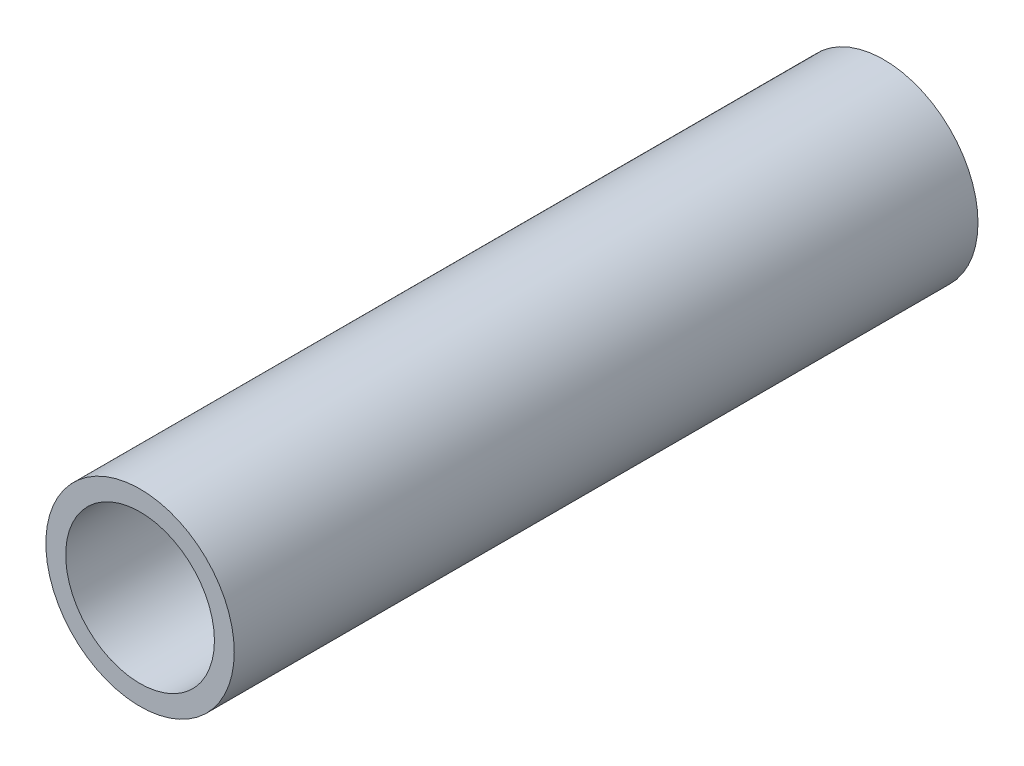
from build123d import *

# Parameters (mm, degrees)
SKETCH_1_R      = 19
SKETCH_1_R_2    = 15
EXTRUDE_1_DEPTH = 150


with BuildPart() as part:
    # ｽｹｯﾁ1 → ﾎﾞｽ - 押し出し1 (new body)
    with BuildSketch(Plane.XY):
        Circle(SKETCH_1_R)
        Circle(SKETCH_1_R_2, mode=Mode.SUBTRACT)
    extrude(amount=EXTRUDE_1_DEPTH)


solid = part.part
